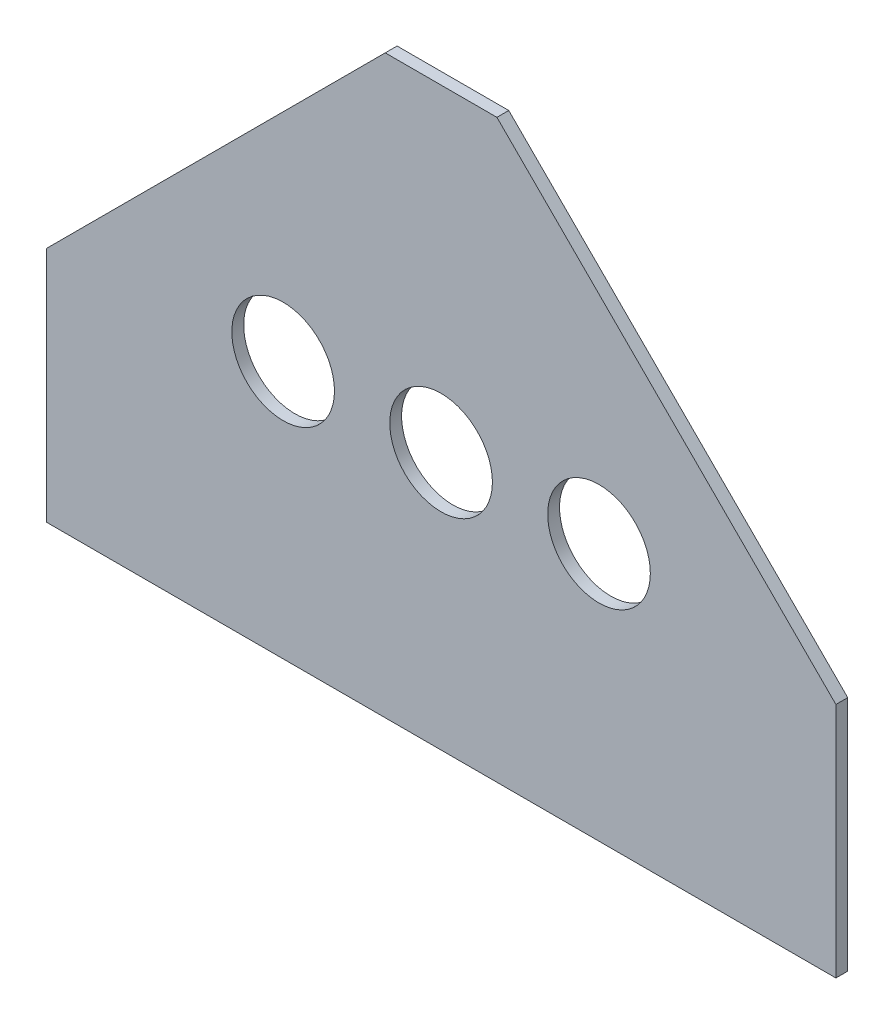
from build123d import *

# Parameters (mm, degrees)
SM_BASE_FLANGE_1_DEPTH     = 1.5
SKETCH_6_R                 = 6.5
CUT_EXTRUDE_1_DEPTH        = 10
PATTERN_LINEAR_1_COUNT     = 2
PATTERN_LINEAR_1_PITCH     = 20
PATTERN_LINEAR_1_COL_COUNT = 2
PATTERN_LINEAR_1_COL_PITCH = 20
CHAMFER_1_SIZE             = 10


# Sheet-metal steps are written as plain solids
with BuildPart() as part:
    # Sketch 1 → Базовая кромка1 (new body)
    with BuildSketch(Plane.XY):
        Polygon((-50, 0), (50, 0), (50, 30), (0, 80), (-50, 30), align=None)
    extrude(amount=-SM_BASE_FLANGE_1_DEPTH)

    # Эскиз6 → Вырез-Вытянуть1 (cut)
    with BuildSketch(Plane.XY):
        with Locations((0, 32.623845661)):
            Circle(SKETCH_6_R)
    cut_extrude_1 = extrude(amount=-CUT_EXTRUDE_1_DEPTH, mode=Mode.SUBTRACT)

    # Линейный массив1: Вырез-Вытянуть1 ×2
    with Locations(*[(-i * PATTERN_LINEAR_1_PITCH, 0, 0) for i in range(1, PATTERN_LINEAR_1_COUNT)]):
        add(cut_extrude_1, mode=Mode.SUBTRACT)

    # Линейный массив1 col: Вырез-Вытянуть1 ×2
    with Locations(*[(i * PATTERN_LINEAR_1_COL_PITCH, 0, 0) for i in range(1, PATTERN_LINEAR_1_COL_COUNT)]):
        add(cut_extrude_1, mode=Mode.SUBTRACT)

    # Фаска1
    chamfer_1_edges = [part.edges().sort_by_distance(p)[0] for p in [
        (0, 80, -0.75),
    ]]
    chamfer(chamfer_1_edges, length=CHAMFER_1_SIZE)


solid = part.part
